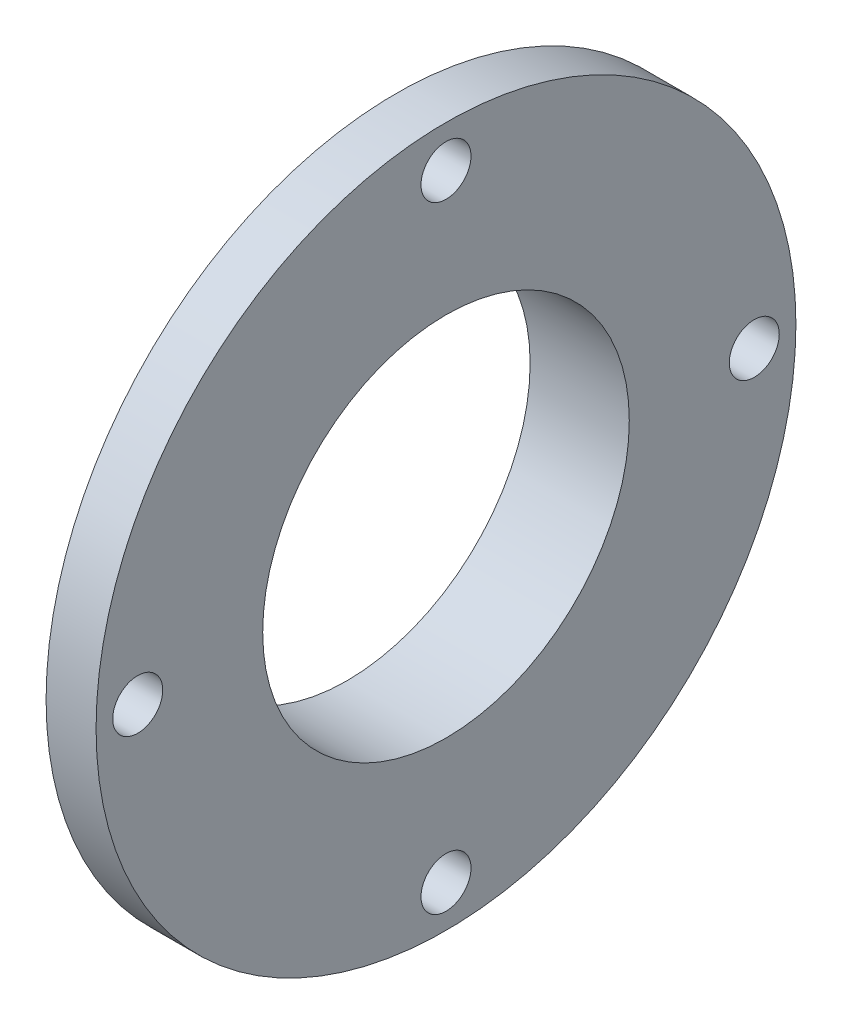
from build123d import *
from build123d.topology import SkipClean

# Parameters (mm, degrees)
SKETCH1_R           = 21
SKETCH1_R_2         = 11
SKETCH1_R_3         = 1.5
BOSS_EXTRUDE1_DEPTH = 3
BOSS_EXTRUDE2_START = 2.95
SKETCH2_R           = 16
SKETCH2_R_2         = 11
BOSS_EXTRUDE2_DEPTH = 2.95


with BuildPart() as part:
    # Sketch1 → Boss-Extrude1 (new body)
    with BuildSketch(Plane(origin=(0, 0, 0), x_dir=(0, 0, -1), z_dir=(1, 0, 0))):
        Circle(SKETCH1_R)
        Circle(SKETCH1_R_2, mode=Mode.SUBTRACT)
        with Locations((0, 18.5)):
            Circle(SKETCH1_R_3, mode=Mode.SUBTRACT)
        with Locations((18.5, 0)):
            Circle(SKETCH1_R_3, mode=Mode.SUBTRACT)
        with Locations((0, -18.5)):
            Circle(SKETCH1_R_3, mode=Mode.SUBTRACT)
        with Locations((-18.5, 0)):
            Circle(SKETCH1_R_3, mode=Mode.SUBTRACT)
    extrude(amount=BOSS_EXTRUDE1_DEPTH)

    # Sketch2 → Boss-Extrude2 (add)
    with SkipClean():  # the faces are left unmerged after this step: merging them gives an invalid solid
        with BuildSketch(Plane.ZY.offset(BOSS_EXTRUDE2_START)):
            Circle(SKETCH2_R)
            Circle(SKETCH2_R_2, mode=Mode.SUBTRACT)
        extrude(amount=-BOSS_EXTRUDE2_DEPTH)


solid = part.part
